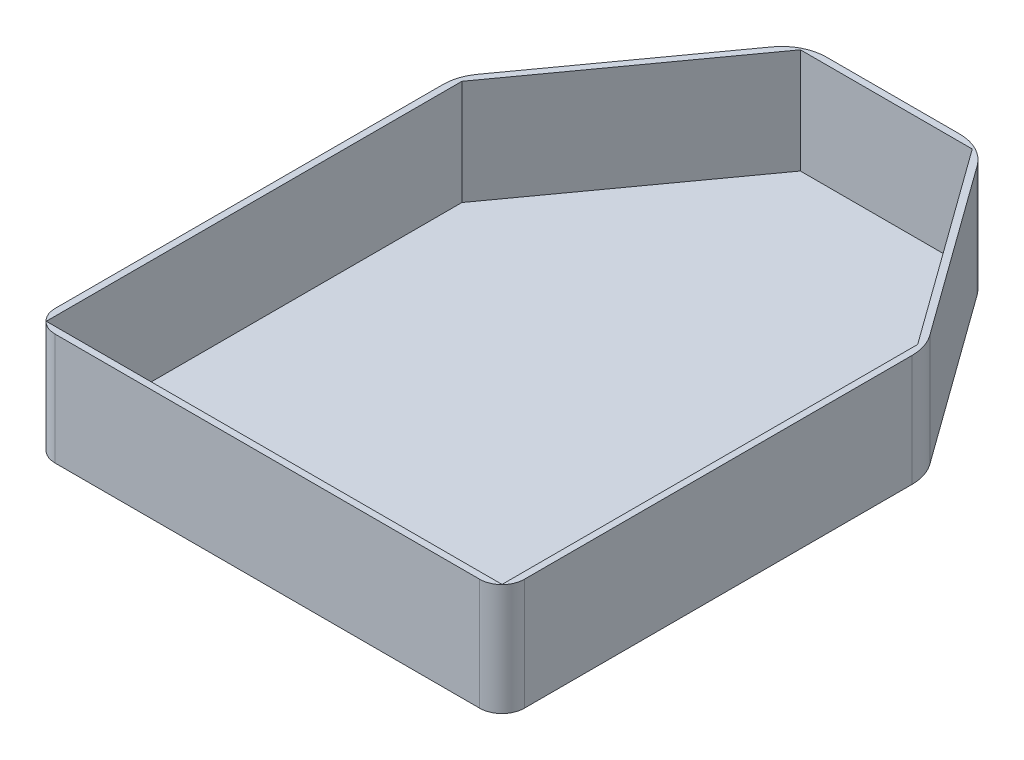
from build123d import *

# Parameters (mm, degrees)
BOSS_EXTRUDE1_DEPTH = 50
SHELL1_T            = -3
FILLET3_R           = 10
FILLET6_R           = 20


with BuildPart() as part:
    # Sketch1 → Boss-Extrude1 (new body)
    with BuildSketch(Plane(origin=(0, 0, 0), x_dir=(1, 0, 0), z_dir=(0, 1, 0))):
        Polygon((-40, 280), (40, 280), (105, 190), (105, 0), (-105, 0), (-105, 190), align=None)
    extrude(amount=BOSS_EXTRUDE1_DEPTH)

    # Shell1
    shell1_openings = [part.faces().sort_by_distance(p)[0] for p in [
        (0, 50, -127.847025496),
    ]]
    offset(amount=SHELL1_T, openings=shell1_openings, kind=Kind.INTERSECTION)

    # Fillet3
    fillet3_edges = [part.edges().sort_by_distance(p)[0] for p in [
        (-105, 25, 0),
        (105, 25, 0),
    ]]
    fillet(fillet3_edges, radius=FILLET3_R)

    # Fillet6
    fillet6_edges = [part.edges().sort_by_distance(p)[0] for p in [
        (105, 25, -190),
        (40, 25, -280),
        (-40, 25, -280),
        (-105, 25, -190),
    ]]
    fillet(fillet6_edges, radius=FILLET6_R)


solid = part.part
